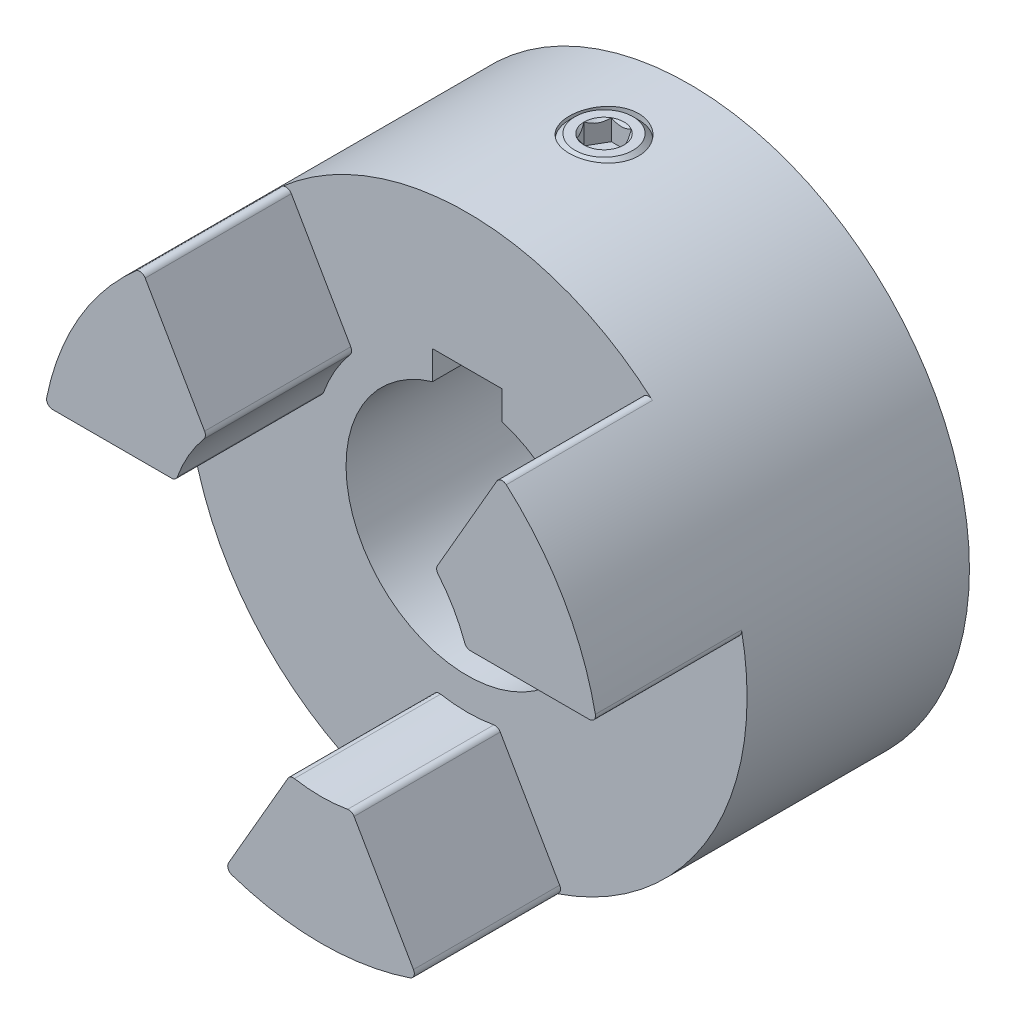
from build123d import *
from OCP.BRepFilletAPI import BRepFilletAPI_MakeChamfer

# Parameters (mm, degrees)
BOSS_EXTRUDE1_START      = -9.128125
SKETCH1_R                = 32.3453125
BOSS_EXTRUDE1_DEPTH      = 26.9875
BOSS_EXTRUDE2_DEPTH      = 16.891
FILLET1_R                = 0.713235825
CIRPATTERN1_COUNT        = 3
FILLET1_OF_CIRPATTERN1_R = 0.713235825
CUT_EXTRUDE5_DEPTH       = 59.281874117
CUT_EXTRUDE5_DEPTH_BACK  = 59.281874117
SKETCH15_R               = 14
CHAMFER1_SIZE            = 1.2938125
CHAMFER1_SIZE2           = 1.918155913
CUT_EXTRUDE1_DEPTH       = 59.281874117
CUT_EXTRUDE1_DEPTH_BACK  = 59.281874117
SKETCH5_R                = 4
CUT_EXTRUDE2_DEPTH       = 59.281874117
SKETCH6_R                = 4
BOSS_EXTRUDE3_DEPTH      = 12
CUT_EXTRUDE3_DEPTH       = 2.4
CHAMFER3_SIZE            = 0.64
CHAMFER4_SIZE            = 1.36


with BuildPart() as part:
    # Sketch1 → Boss-Extrude1 (new body)
    with BuildSketch(Plane.XY.offset(BOSS_EXTRUDE1_START)):
        Circle(SKETCH1_R)
    extrude(amount=-BOSS_EXTRUDE1_DEPTH)

    # Sketch2 → Boss-Extrude2 (add)
    with BuildSketch(Plane.XY.offset(-9.128125)):
        with BuildLine():
            Line((-11.114350717, -30.375820135), (-3.566179127, -17.302003437))
            ThreePointArc((-3.566179127, -17.302003437), (0, -17.6657), (3.566179127, -17.302003437))
            Line((3.566179127, -17.302003437), (11.114350717, -30.375820135))
            ThreePointArc((11.114350717, -30.375820135), (0, -32.3453125), (-11.114350717, -30.375820135))
        make_face()
    boss_extrude2 = extrude(amount=BOSS_EXTRUDE2_DEPTH)

    # Fillet1
    # the kernel refuses this fillet: 0.713235825 mm, written as the material it takes off along each edge
    with BuildSketch(Plane(origin=(-11.114350717, -30.375820135, -9.128125), x_dir=(0.9436455754007305, -0.3309577435664929, 0), z_dir=(0, 0, 1))) as fillet1_piece_1:
        with BuildLine():
            CenterArc((0.860200247, 0.713171354), FILLET1_R, 169.326916929, 101.443469756)
            Line((0.159303464, 0.845266176), (0, 0))
            ThreePointArc((0, 0), (0.434894987, -0.002923796), (0.869789973, 0))
        make_face()
    extrude(amount=19.065474933, mode=Mode.SUBTRACT)
    with BuildSketch(Plane(origin=(11.114350717, -30.375820135, -9.128125), x_dir=(-0.9436455754007282, -0.3309577435664989, 0), z_dir=(0, 0, 1))) as fillet1_piece_2:
        with BuildLine():
            CenterArc((0.860200247, -0.713171354), FILLET1_R, 89.229613314, 101.443469756)
            Line((0.159303464, -0.845266176), (0, 0))
            ThreePointArc((0, 0), (0.434894987, 0.002923796), (0.869789973, 0))
        make_face()
    extrude(amount=19.065474933, mode=Mode.SUBTRACT)
    with BuildSketch(Plane(origin=(3.566179127, -17.302003437, -9.128125), x_dir=(0.500000000000002, -0.8660254037844376, 0), z_dir=(0, 0, 1))) as fillet1_piece_3:
        with BuildLine():
            CenterArc((0.507170112, -0.713235825), FILLET1_R, 90, 70.033604576)
            ThreePointArc((-0.163195289, -0.469687941), (-0.07994504, -0.235418176), (0, 0))
            Line((0, 0), (0.507170112, 0))
        make_face()
    extrude(amount=18.158925279, mode=Mode.SUBTRACT)
    with BuildSketch(Plane(origin=(-3.566179127, -17.302003437, -9.128125), x_dir=(0.9821562739684868, -0.18806661985673784, 0), z_dir=(0, 0, 1))) as fillet1_piece_4:
        with BuildLine():
            CenterArc((0.507269431, -0.71316519), FILLET1_R, 90.806371221, 70.033604577)
            Line((-0.166457119, -0.479075724), (0, 0))
            ThreePointArc((0, 0), (0.248615901, -0.001749518), (0.497231801, 0))
        make_face()
    extrude(amount=18.158925279, mode=Mode.SUBTRACT)

    # CirPattern1: Boss-Extrude2 ×3 about axis
    cirpattern1_axis = Axis((0, 0, 0), (0, 0, 1))
    for i in range(1, CIRPATTERN1_COUNT):
        add(boss_extrude2.rotate(cirpattern1_axis, i * 360 / CIRPATTERN1_COUNT))

    # Fillet1 of CirPattern1
    # the kernel refuses this fillet: 0.713235825 mm, written as the material it takes off along each edge
    with BuildSketch(Plane(origin=(31.863407256, 5.5626, -9.128125), x_dir=(-0.18520497419260348, 0.9826999122490635, 0), z_dir=(0, 0, 1)), Plane(origin=(-20.749056539, 24.813220135, -9.128125), x_dir=(-0.7584406012081224, -0.6517421686825718, 0), z_dir=(0, 0, 1))) as fillet1_of_cirpattern1_piece_1:
        with BuildLine():
            CenterArc((0.860200247, 0.713171354), FILLET1_OF_CIRPATTERN1_R, 169.326916929, 101.443469756)
            Line((0.159303464, 0.845266176), (0, 0))
            ThreePointArc((0, 0), (0.434894987, -0.002923796), (0.869789973, 0))
        make_face()
    extrude(amount=19.065474933, mode=Mode.SUBTRACT)
    with BuildSketch(Plane(origin=(20.749056539, 24.813220135, -9.128125), x_dir=(0.7584406012081266, -0.6517421686825667, 0), z_dir=(0, 0, 1)), Plane(origin=(-31.863407256, 5.5626, -9.128125), x_dir=(0.18520497419260348, 0.9826999122490635, 0), z_dir=(0, 0, 1))) as fillet1_of_cirpattern1_piece_2:
        with BuildLine():
            CenterArc((0.860200247, -0.713171354), FILLET1_OF_CIRPATTERN1_R, 89.229613314, 101.443469756)
            Line((0.159303464, -0.845266176), (0, 0))
            ThreePointArc((0, 0), (0.434894987, 0.002923796), (0.869789973, 0))
        make_face()
    extrude(amount=19.065474933, mode=Mode.SUBTRACT)
    with BuildSketch(Plane(origin=(13.200884949, 11.739403437, -9.128125), x_dir=(0.49999999999999967, 0.8660254037844388, 0), z_dir=(0, 0, 1)), Plane(origin=(-16.767064076, 5.5626, -9.128125), x_dir=(-1, 0, 0), z_dir=(0, 0, 1))) as fillet1_of_cirpattern1_piece_3:
        with BuildLine():
            CenterArc((0.507170112, -0.713235825), FILLET1_OF_CIRPATTERN1_R, 90, 70.033604576)
            ThreePointArc((-0.163195289, -0.469687941), (-0.07994504, -0.235418176), (0, 0))
            Line((0, 0), (0.507170112, 0))
        make_face()
    extrude(amount=18.158925279, mode=Mode.SUBTRACT)
    with BuildSketch(Plane(origin=(16.767064076, 5.5626, -9.128125), x_dir=(-0.3282076665844337, 0.9446055936713488, 0), z_dir=(0, 0, 1)), Plane(origin=(-13.200884949, 11.739403437, -9.128125), x_dir=(-0.6539486073840537, -0.7565389738146059, 0), z_dir=(0, 0, 1))) as fillet1_of_cirpattern1_piece_4:
        with BuildLine():
            CenterArc((0.507269431, -0.71316519), FILLET1_OF_CIRPATTERN1_R, 90.806371221, 70.033604577)
            Line((-0.166457119, -0.479075724), (0, 0))
            ThreePointArc((0, 0), (0.248615901, -0.001749518), (0.497231801, 0))
        make_face()
    extrude(amount=18.158925279, mode=Mode.SUBTRACT)

    # Sketch15 → Cut-Extrude5 (cut, two sides: drawn at the far end of the back side and taken through both)
    with BuildSketch(Plane.XY.offset(-CUT_EXTRUDE5_DEPTH_BACK)):
        Circle(SKETCH15_R)
    extrude(amount=CUT_EXTRUDE5_DEPTH + CUT_EXTRUDE5_DEPTH_BACK, mode=Mode.SUBTRACT)

    # Chamfer1: one chamfer whose edges measure the first distance from different faces: ONE call of the kernel's chamfer builder (chamfer() names one face for all edges)
    chamfer1_edges_1 = [part.edges().sort_by_distance(p)[0] for p in [
        (-32.3453125, 0, -36.115625),
    ]]
    chamfer1_side_1 = [part.faces().sort_by_distance(p)[0] for p in [
        (-32.3453125, 0, -22.621875),
    ]]
    chamfer1_edges_2 = [part.edges().sort_by_distance(p)[0] for p in [
        (-14, 0, -36.115625),
    ]]
    chamfer1_side_2 = [part.faces().sort_by_distance(p)[0] for p in [
        (-14, 0, -22.621875),
    ]]
    chamfer1 = BRepFilletAPI_MakeChamfer(part.part.solid().wrapped)
    for e in chamfer1_edges_1:
        chamfer1.Add(CHAMFER1_SIZE, CHAMFER1_SIZE2, e.wrapped, chamfer1_side_1[0].wrapped)  # the first distance lies on this face
    for e in chamfer1_edges_2:
        chamfer1.Add(CHAMFER1_SIZE, CHAMFER1_SIZE2, e.wrapped, chamfer1_side_2[0].wrapped)  # the first distance lies on this face
    add(Compound.cast(chamfer1.Shape()), mode=Mode.REPLACE)

    # Sketch4 → Cut-Extrude1 (cut, two sides: drawn at the far end of the back side and taken through both)
    with BuildSketch(Plane.XY.offset(-CUT_EXTRUDE1_DEPTH_BACK)):
        with BuildLine():
            Line((-4, 16.716407865), (4, 16.716407865))
            Line((4, 16.716407865), (4, 13.416407865))
            ThreePointArc((4, 13.416407865), (0, 14), (-4, 13.416407865))
            Line((-4, 13.416407865), (-4, 16.716407865))
        make_face()
    extrude(amount=CUT_EXTRUDE1_DEPTH + CUT_EXTRUDE1_DEPTH_BACK, mode=Mode.SUBTRACT)

    # Sketch5 → Cut-Extrude2 (cut, through all)
    with BuildSketch(Plane(origin=(0, 0, 0), x_dir=(1, 0, 0), z_dir=(0, 1, 0))):
        with Locations(Location((0, 24.939625, 0), (0, 0, 90))):
            Circle(SKETCH5_R)
    extrude(amount=CUT_EXTRUDE2_DEPTH, mode=Mode.SUBTRACT)


with BuildPart() as body_2:
    # Sketch6 → Boss-Extrude3 (new body)
    with BuildSketch(Plane(origin=(0, 32.3453125, 0), x_dir=(-1, 0, 0), z_dir=(0, 1, 0))):
        with Locations(Location((0, -24.939625, 0), (0, 0, 90))):
            Circle(SKETCH6_R)
    extrude(amount=-BOSS_EXTRUDE3_DEPTH)

    # Sketch8 → Cut-Extrude3 (cut)
    with BuildSketch(Plane(origin=(0, 32.3453125, 0), x_dir=(1, 0, 0), z_dir=(0, 1, 0))):
        Polygon((1.154700538, 22.939625), (2.309401077, 24.939625), (1.154700538, 26.939625), (-1.154700538, 26.939625), (-2.309401077, 24.939625), (-1.154700538, 22.939625), align=None)
    extrude(amount=-CUT_EXTRUDE3_DEPTH, mode=Mode.SUBTRACT)

    # Cut-Extrude4 cone 1 section (through the dimple's axis) → Cut-Extrude4 (revolve, cut)
    with BuildSketch(Plane(origin=(0, 32.3453125, -24.939625), x_dir=(0, 0, 1), z_dir=(1, 0, 0))):
        Polygon((0, 0), (2.309401077, 0), (0, 2.309401077), align=None)
    revolve(axis=Axis((0, 32.3453125, -24.939625), (0, -1, 0)), mode=Mode.SUBTRACT)

    # Chamfer3
    chamfer3_edges = [body_2.edges().sort_by_distance(p)[0] for p in [
        (0, 32.3453125, -28.939625),
    ]]
    chamfer(chamfer3_edges, length=CHAMFER3_SIZE)

    # Chamfer4
    chamfer4_edges = [body_2.edges().sort_by_distance(p)[0] for p in [
        (0, 20.3453125, -28.939625),
    ]]
    chamfer(chamfer4_edges, length=CHAMFER4_SIZE)


solid = Compound([part.part, body_2.part])
